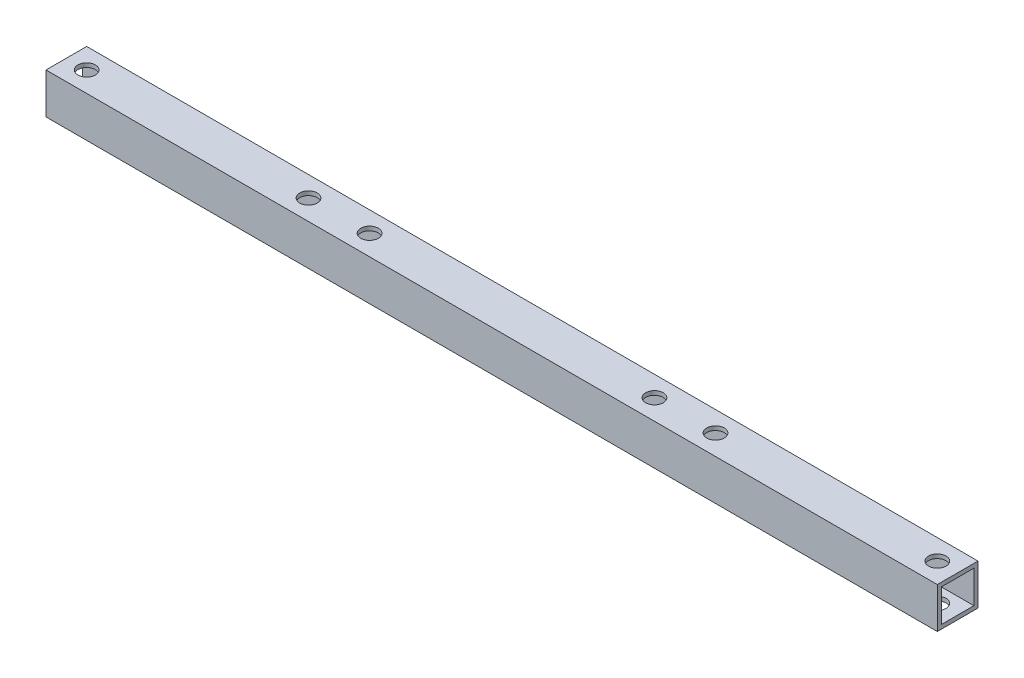
from build123d import *

# Parameters (mm, degrees)
SKETCH_1_W          = 10
SKETCH_1_H          = 10
SKETCH_1_W_2        = 8
SKETCH_1_H_2        = 8
EXTRUDE_1_DEPTH     = 219
SKETCH_2_R          = 2.15
CUT_EXTRUDE_1_DEPTH = 220.285202419


with BuildPart() as part:
    # ｽｹｯﾁ1 → 押し出し-薄板1 (new body)
    with BuildSketch(Plane(origin=(0, 0, 0), x_dir=(0, 0, -1), z_dir=(1, 0, 0))):
        Rectangle(SKETCH_1_W, SKETCH_1_H)
        Rectangle(SKETCH_1_W_2, SKETCH_1_H_2, mode=Mode.SUBTRACT)
    extrude(amount=EXTRUDE_1_DEPTH)

    # ｽｹｯﾁ2 → ｶｯﾄ - 押し出し1 (cut, through all)
    with BuildSketch(Plane(origin=(0, 5, 0), x_dir=(1, 0, 0), z_dir=(0, 1, 0))):
        with Locations((5, 0)):
            Circle(SKETCH_2_R)
        with Locations((214, 0)):
            Circle(SKETCH_2_R)
        with Locations((159.5, 0)):
            Circle(SKETCH_2_R)
        with Locations((59.5, 0)):
            Circle(SKETCH_2_R)
        with Locations((144.5, 0)):
            Circle(SKETCH_2_R)
        with Locations((74.5, 0)):
            Circle(SKETCH_2_R)
    extrude(amount=-CUT_EXTRUDE_1_DEPTH, mode=Mode.SUBTRACT)


solid = part.part
